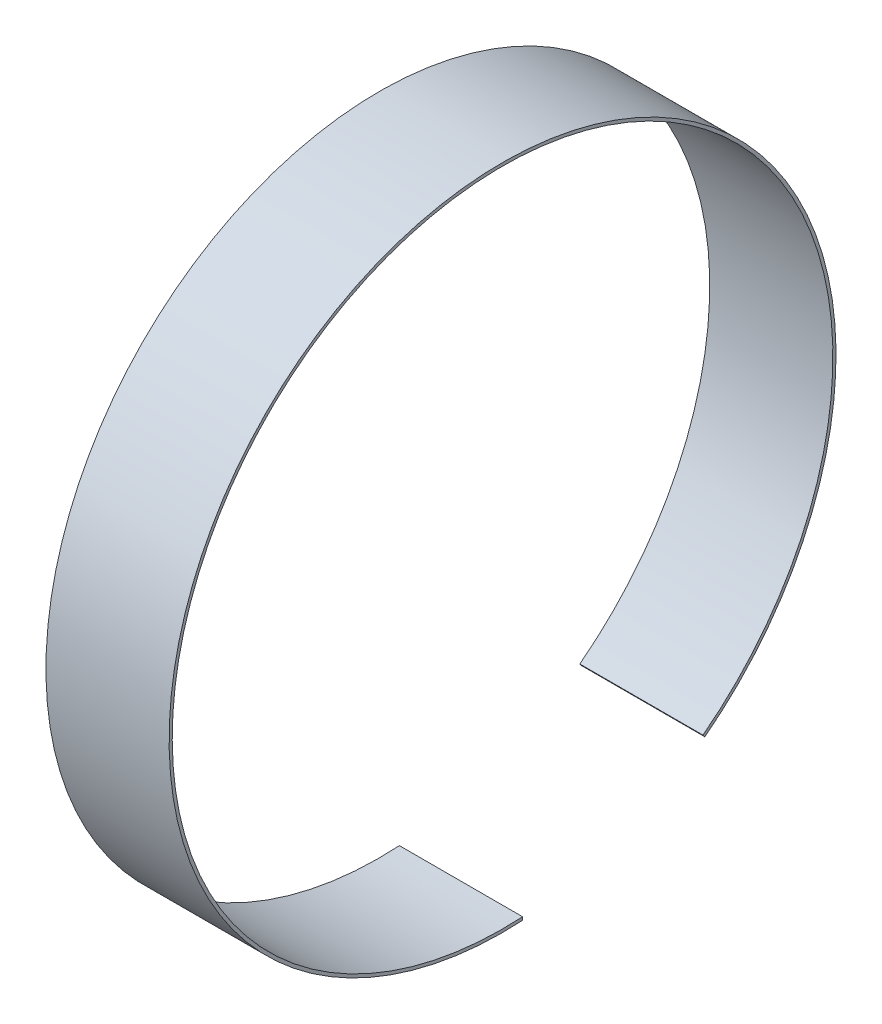
from build123d import *

# Parameters (mm, degrees)
BOSS_EXTRUDE1_DEPTH = 13.85


with BuildPart() as part:
    # Sketch1 → Boss-Extrude1 (new, symmetric)
    with BuildSketch(Plane(origin=(0, 0, 0), x_dir=(0, 0, -1), z_dir=(1, 0, 0))):
        with BuildLine():
            ThreePointArc((4.5, -74.163602933), (-25.911743435, 69.6352752), (45.075333333, -59.065254803))
            Line((45.075333333, -59.065254803), (45.5, -59.621724229))
            ThreePointArc((45.5, -59.621724229), (-26.135960598, 70.298730882), (4.5, -74.864878281))
            Line((4.5, -74.864878281), (4.5, -74.163602933))
        make_face()
    extrude(amount=BOSS_EXTRUDE1_DEPTH, both=True)


solid = part.part
